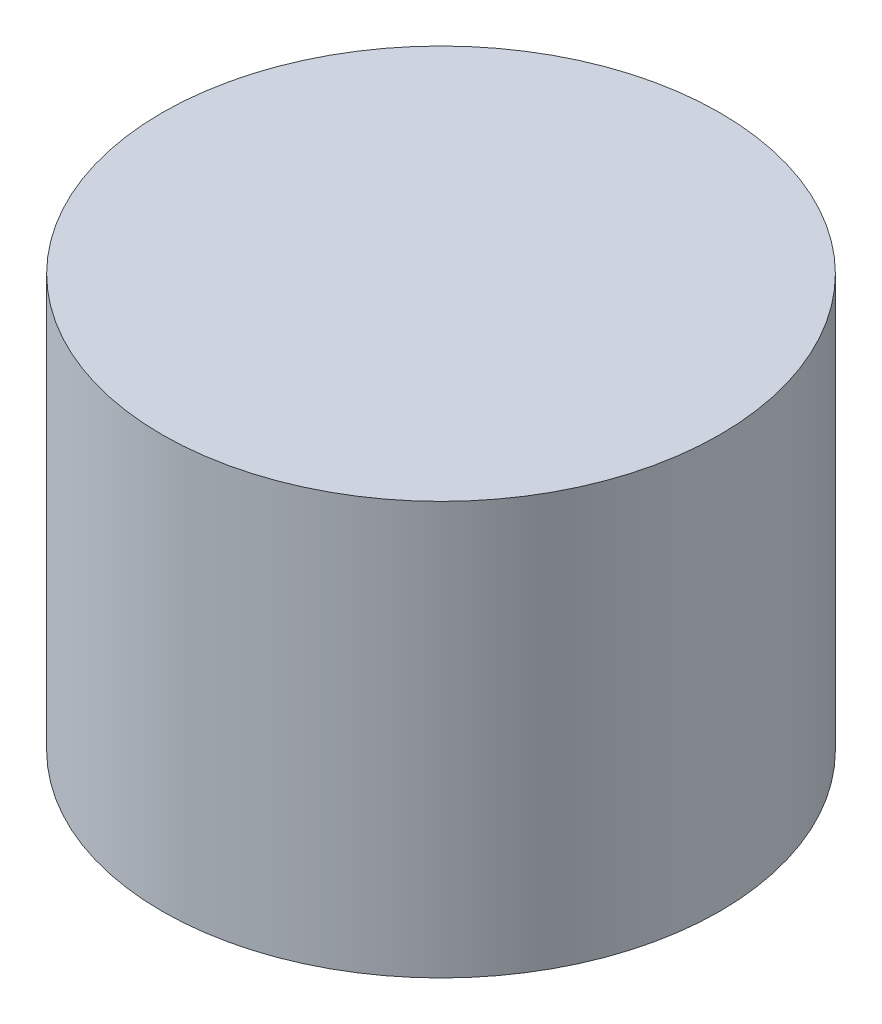
from build123d import *

# Parameters (mm, degrees)
ENL_V_MAT_EXTRU_1_DEPTH = 4
CONG_1_R                = 2
ESQUISSE3_R             = 1.65
ENL_V_MAT_EXTRU_2_DEPTH = 20


with BuildPart() as part:
    # Esquisse1 → Révolution2 (revolve)
    with BuildSketch(Plane.XY, mode=Mode.PRIVATE) as r_volution2_sk:
        with BuildLine():
            Line((-7.394355414, 1.254395478), (-11, -20))
            Line((-11, -20), (-8, -20))
            Line((-8, -20), (-8, -22))
            Line((-8, -22), (-25, -22))
            Line((-25, -22), (-25, -20))
            Line((-25, -20), (-25, 15))
            Line((-25, 15), (0, 15))
            Line((0, 15), (0, 7.5))
            ThreePointArc((0, 7.5), (-4.839526522, 5.729658196), (-7.394355414, 1.254395478))
        make_face()
    revolve(r_volution2_sk.sketch.rotate(Axis((0, 7.5, 0), (0, 1, 0)), 180), axis=Axis((0, 7.5, 0), (0, 1, 0)))

    # Esquisse2 → Enlèv. mat.-Extru.1 (cut)
    with BuildSketch(Plane.XZ.offset(22)):
        Polygon((9.814954576, 0), (4.907477288, 8.5), (-4.907477288, 8.5), (-9.814954576, 0), (-4.907477288, -8.5), (4.907477288, -8.5), align=None)
    extrude(amount=-ENL_V_MAT_EXTRU_1_DEPTH, mode=Mode.SUBTRACT)

    # Congé1
    # the kernel refuses this fillet: 2 mm, written as the material it adds along each edge
    with BuildSketch(Plane(origin=(0, -20, 0), x_dir=(1, 0, 0), z_dir=(0, 0, 1))) as cong_1_piece_1_section:
        with BuildLine():
            CenterArc((11 - CONG_1_R * 1.1839294959, CONG_1_R), CONG_1_R, 270, 99.628125236)
            Line((11 - CONG_1_R * 1.1839294959, 0), (11, 0))
            Line((11, 0), (11 - CONG_1_R * 0.198015440727, CONG_1_R * 1.16725273035))
        make_face()
    cong_1_piece_1 = revolve(axis=Axis((0, -20, 0), (0, 1, 0)), mode=Mode.PRIVATE)
    cong_1_piece_1 = split(cong_1_piece_1, bisect_by=Plane(origin=(10.002736097, -19.349469748, 0.325247134), z_dir=(0.8660254037844389, 0, -0.49999999999999956)), keep=Keep.TOP, mode=Mode.PRIVATE)
    with BuildSketch(Plane(origin=(0, -20, 0), x_dir=(1, 0, 0), z_dir=(0, 0, 1))) as cong_1_piece_2_section:
        with BuildLine():
            CenterArc((11 - CONG_1_R * 1.1839294959, CONG_1_R), CONG_1_R, 270, 99.628125236)
            Line((11 - CONG_1_R * 1.1839294959, 0), (11, 0))
            Line((11, 0), (11 - CONG_1_R * 0.198015440727, CONG_1_R * 1.16725273035))
        make_face()
    cong_1_piece_2 = revolve(axis=Axis((0, -20, 0), (0, 1, 0)), mode=Mode.PRIVATE)
    cong_1_piece_2 = split(cong_1_piece_2, bisect_by=Plane(origin=(7.361215688, -19.472047685, 4.250000423), z_dir=(0.8660254037844387, 0, 0.5000000000000003)), keep=Keep.TOP, mode=Mode.PRIVATE)
    with BuildSketch(Plane(origin=(0, -20, 0), x_dir=(1, 0, 0), z_dir=(0, 0, 1))) as cong_1_piece_3_section:
        with BuildLine():
            CenterArc((11 - CONG_1_R * 1.1839294959, CONG_1_R), CONG_1_R, 270, 99.628125236)
            Line((11 - CONG_1_R * 1.1839294959, 0), (11, 0))
            Line((11, 0), (11 - CONG_1_R * 0.198015440727, CONG_1_R * 1.16725273035))
        make_face()
    cong_1_piece_3 = revolve(axis=Axis((0, -20, 0), (0, 1, 0)), mode=Mode.PRIVATE)
    cong_1_piece_3 = split(cong_1_piece_3, bisect_by=Plane(origin=(-2.9e-08, -19.472047136, -8.5), z_dir=(0, 0, -1)), keep=Keep.TOP, mode=Mode.PRIVATE)
    with BuildSketch(Plane(origin=(0, -20, 0), x_dir=(1, 0, 0), z_dir=(0, 0, 1))) as cong_1_piece_4_section:
        with BuildLine():
            CenterArc((11 - CONG_1_R * 1.1839294959, CONG_1_R), CONG_1_R, 270, 99.628125236)
            Line((11 - CONG_1_R * 1.1839294959, 0), (11, 0))
            Line((11, 0), (11 - CONG_1_R * 0.198015440727, CONG_1_R * 1.16725273035))
        make_face()
    cong_1_piece_4 = revolve(axis=Axis((0, -20, 0), (0, 1, 0)), mode=Mode.PRIVATE)
    cong_1_piece_4 = split(cong_1_piece_4, bisect_by=Plane(origin=(2.9e-08, -19.472047136, 8.5), z_dir=(0, 0, 1)), keep=Keep.TOP, mode=Mode.PRIVATE)
    with BuildSketch(Plane(origin=(0, -20, 0), x_dir=(1, 0, 0), z_dir=(0, 0, 1))) as cong_1_piece_5_section:
        with BuildLine():
            CenterArc((11 - CONG_1_R * 1.1839294959, CONG_1_R), CONG_1_R, 270, 99.628125236)
            Line((11 - CONG_1_R * 1.1839294959, 0), (11, 0))
            Line((11, 0), (11 - CONG_1_R * 0.198015440727, CONG_1_R * 1.16725273035))
        make_face()
    cong_1_piece_5 = revolve(axis=Axis((0, -20, 0), (0, 1, 0)), mode=Mode.PRIVATE)
    cong_1_piece_5 = split(cong_1_piece_5, bisect_by=Plane(origin=(-7.361215946, -19.472047136, -4.249999975), z_dir=(-0.8660254037844387, 0, -0.5000000000000001)), keep=Keep.TOP, mode=Mode.PRIVATE)
    with BuildSketch(Plane(origin=(0, -20, 0), x_dir=(1, 0, 0), z_dir=(0, 0, 1))) as cong_1_piece_6_section:
        with BuildLine():
            CenterArc((11 - CONG_1_R * 1.1839294959, CONG_1_R), CONG_1_R, 270, 99.628125236)
            Line((11 - CONG_1_R * 1.1839294959, 0), (11, 0))
            Line((11, 0), (11 - CONG_1_R * 0.198015440727, CONG_1_R * 1.16725273035))
        make_face()
    cong_1_piece_6 = revolve(axis=Axis((0, -20, 0), (0, 1, 0)), mode=Mode.PRIVATE)
    cong_1_piece_6 = split(cong_1_piece_6, bisect_by=Plane(origin=(-7.361215918, -19.472047136, 4.250000025), z_dir=(-0.8660254037844387, 0, 0.4999999999999999)), keep=Keep.TOP, mode=Mode.PRIVATE)
    add([cong_1_piece_1, cong_1_piece_2, cong_1_piece_3, cong_1_piece_4, cong_1_piece_5, cong_1_piece_6])

    # Esquisse3 → Enlèv. mat.-Extru.2 (cut)
    with BuildSketch(Plane.XZ.offset(22)):
        with Locations((10.606601718, -10.606601718)):
            Circle(ESQUISSE3_R)
        with Locations((-10.606601718, -10.606601718)):
            Circle(ESQUISSE3_R)
        with Locations((-10.606601718, 10.606601718)):
            Circle(ESQUISSE3_R)
        with Locations((10.606601718, 10.606601718)):
            Circle(ESQUISSE3_R)
    extrude(amount=-ENL_V_MAT_EXTRU_2_DEPTH, mode=Mode.SUBTRACT)


solid = part.part
